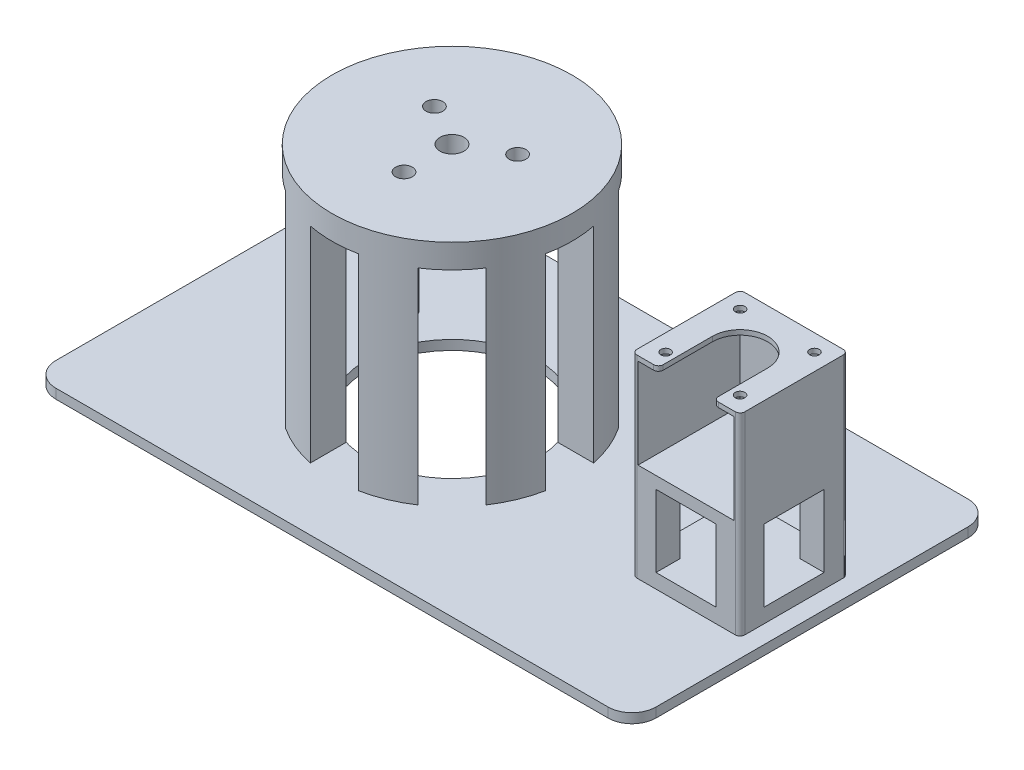
from build123d import *

# Parameters (mm, degrees)
SKETCH1_R            = 50
BOSS_EXTRUDE1_DEPTH  = 99.5
BOSS_EXTRUDE2_DEPTH  = 4
SKETCH3_R            = 5
CUT_EXTRUDE1_DEPTH   = 20
SKETCH6_R            = 35.5
CUT_EXTRUDE2_DEPTH   = 89.5
SKETCH7_W            = 20
SKETCH7_H            = 85.5
CUT_EXTRUDE3_DEPTH   = 196.000641025
CIRPATTERN1_COUNT    = 8
SKETCH8_R            = 4.5
SKETCH8_R_2          = 1.5
EXTRUDE_THIN1_DEPTH  = 40
SKETCH8_2_R          = 1.5
CUT_EXTRUDE4_DEPTH   = 191.092740524
SKETCH9_R            = 3.5
CUT_EXTRUDE5_DEPTH   = 5
FILLET1_R            = 2
SKETCH4_W            = 45
SKETCH4_H            = 45
BOSS_EXTRUDE3_DEPTH  = 41
EXTRUDE_THIN2_DEPTH  = 37.5
SKETCH11_R           = 2
BOSS_EXTRUDE4_DEPTH  = 2
FILLET2_R            = 2
SKETCH12_W           = 25
SKETCH12_H           = 30
CUT_EXTRUDE6_DEPTH   = 205.710771578
CUT_EXTRUDE7_REACH   = 274.638
SKETCH13_W           = 25
SKETCH13_H           = 30
SPLIT1_START         = 4
SPLIT1_OUTLINE_R     = 50
SPLIT1_OUTLINE_R_2   = 5
SPLIT1_OUTLINE_R_3   = 1.5
SPLIT1_DEPTH         = 95.5
SPLIT1_2_DEPTH       = 95.5
SPLIT1_START_2       = 89.5
SPLIT1_3_OUTLINE_R   = 3.5
SPLIT1_3_OUTLINE_R_2 = 5
SPLIT1_3_DEPTH       = 10
SPLIT1_START_3       = 49.5
SPLIT1_4_OUTLINE_R   = 4.5
SPLIT1_4_OUTLINE_R_2 = 1.5
SPLIT1_4_DEPTH       = 45
SPLIT1_8_DEPTH       = 41
SPLIT1_START_4       = 40
SPLIT1_9_DEPTH       = 44.5
SPLIT1_10_DEPTH      = 6
SPLIT1_11_DEPTH      = 5
SPLIT1_START_5       = 82.5
SPLIT1_12_OUTLINE_R  = 2
SPLIT1_12_DEPTH      = 2


with BuildPart() as part:
    # Sketch1 → Boss-Extrude1 (new body)
    with BuildSketch(Plane(origin=(0, 0, 0), x_dir=(1, 0, 0), z_dir=(0, 1, 0))):
        with Locations(Location((0, 0, 0), (0, 0, 270))):
            Circle(SKETCH1_R)
    extrude(amount=BOSS_EXTRUDE1_DEPTH)

    # Sketch2 → Boss-Extrude2 (add)
    with BuildSketch(Plane(origin=(0, 0, 0), x_dir=(1, 0, 0), z_dir=(0, 1, 0))):
        with BuildLine():
            Line((-90, 75), (140, 75))
            ThreePointArc((140, 75), (147.071067812, 72.071067812), (150, 65))
            Line((150, 65), (150, -65))
            ThreePointArc((150, -65), (147.071067812, -72.071067812), (140, -75))
            Line((140, -75), (-90, -75))
            ThreePointArc((-90, -75), (-97.071067812, -72.071067812), (-100, -65))
            Line((-100, -65), (-100, 65))
            ThreePointArc((-100, 65), (-97.071067812, 72.071067812), (-90, 75))
        make_face()
    extrude(amount=BOSS_EXTRUDE2_DEPTH)

    # Sketch3 → Cut-Extrude1 (cut)
    with BuildSketch(Plane(origin=(0, 99.5, 0), x_dir=(1, 0, 0), z_dir=(0, 1, 0))):
        with Locations(Location((0, 0, 0), (0, 0, 270))):
            Circle(SKETCH3_R)
    extrude(amount=-CUT_EXTRUDE1_DEPTH, mode=Mode.SUBTRACT)

    # Sketch6 → Cut-Extrude2 (cut)
    with BuildSketch(Plane.XZ):
        with Locations(Location((0, 0, 0), (0, 0, 270))):
            Circle(SKETCH6_R)
    extrude(amount=-CUT_EXTRUDE2_DEPTH, mode=Mode.SUBTRACT)

    # Sketch7 → Cut-Extrude3 (cut, symmetric)
    with BuildSketch(Plane.XY):
        with Locations((0, 46.75)):
            Rectangle(SKETCH7_W, SKETCH7_H)
    cut_extrude3 = extrude(amount=CUT_EXTRUDE3_DEPTH, both=True, mode=Mode.SUBTRACT)

    # CirPattern1: Cut-Extrude3 ×8 about axis
    cirpattern1_axis = Axis((0, 0, 0), (0, 1, 0))
    for i in range(1, CIRPATTERN1_COUNT):
        add(cut_extrude3.rotate(cirpattern1_axis, i * 360 / CIRPATTERN1_COUNT), mode=Mode.SUBTRACT)

    # Sketch8 → Extrude-Thin1 (add)
    # profile 1 of 3: a face of its own
    with BuildSketch(Plane.XZ.offset(-89.5)):
        with Locations((0, 20)):
            Circle(SKETCH8_R)
        with Locations((0, 20)):
            Circle(SKETCH8_R_2, mode=Mode.SUBTRACT)
    # profile 2 of 3: a face of its own
    with BuildSketch(Plane.XZ.offset(-89.5)):
        with Locations((17.320508076, -10)):
            Circle(SKETCH8_R)
        with Locations((17.320508076, -10)):
            Circle(SKETCH8_R_2, mode=Mode.SUBTRACT)
    # profile 3 of 3: a face of its own
    with BuildSketch(Plane.XZ.offset(-89.5)):
        with Locations((-17.320508076, -10)):
            Circle(SKETCH8_R)
        with Locations((-17.320508076, -10)):
            Circle(SKETCH8_R_2, mode=Mode.SUBTRACT)
    extrude(amount=EXTRUDE_THIN1_DEPTH)

    # Sketch8<2> → Cut-Extrude4 (cut, through all)
    with BuildSketch(Plane.XZ.offset(-89.5)):
        with Locations(Location((0, 20, 0), (0, 0, 270))):
            Circle(SKETCH8_2_R)
        with Locations(Location((17.320508076, -10, 0), (0, 0, 270))):
            Circle(SKETCH8_2_R)
        with Locations(Location((-17.320508076, -10, 0), (0, 0, 270))):
            Circle(SKETCH8_2_R)
    extrude(amount=-CUT_EXTRUDE4_DEPTH, mode=Mode.SUBTRACT)

    # Sketch9 → Cut-Extrude5 (cut)
    with BuildSketch(Plane(origin=(0, 99.5, 0), x_dir=(1, 0, 0), z_dir=(0, 1, 0))):
        with Locations(Location((0, -20, 0), (0, 0, 270))):
            Circle(SKETCH9_R)
        with Locations(Location((-17.320508076, 10, 0), (0, 0, 270))):
            Circle(SKETCH9_R)
        with Locations(Location((17.320508076, 10, 0), (0, 0, 270))):
            Circle(SKETCH9_R)
    extrude(amount=-CUT_EXTRUDE5_DEPTH, mode=Mode.SUBTRACT)

    # Fillet1
    fillet1_edges = [part.edges().sort_by_distance(p)[0] for p in [
        (-4.5, 89.5, 20),
        (12.820508076, 89.5, -10),
        (-21.820508076, 89.5, -10),
    ]]
    fillet(fillet1_edges, radius=FILLET1_R)

    # Sketch4 → Boss-Extrude3 (add)
    with BuildSketch(Plane(origin=(0, 4, 0), x_dir=(1, 0, 0), z_dir=(0, 1, 0))):
        with Locations((120, 0)):
            Rectangle(SKETCH4_W, SKETCH4_H)
    extrude(amount=BOSS_EXTRUDE3_DEPTH)

    # Sketch10 → Extrude-Thin2 (add)
    with BuildSketch(Plane(origin=(0, 45, 0), x_dir=(1, 0, 0), z_dir=(0, 1, 0))):
        Polygon((97.5, -22.5), (97.5, 22.5), (142.5, 22.5), (142.5, -22.5), (140, -22.5), (140, 20), (100, 20), (100, -22.5), align=None)
    extrude(amount=EXTRUDE_THIN2_DEPTH)

    # Sketch11 → Boss-Extrude4 (add)
    # profile 1 of 2: a face of its own
    with BuildSketch(Plane(origin=(0, 82.5, 0), x_dir=(1, 0, 0), z_dir=(0, 1, 0))):
        Polygon((100, 20), (140, 20), (140, -22.5), (142.5, -22.5), (142.5, 22.5), (97.5, 22.5), (97.5, -22.5), (100, -22.5), align=None)
    # profile 2 of 2: a face of its own
    with BuildSketch(Plane(origin=(0, 82.5, 0), x_dir=(1, 0, 0), z_dir=(0, 1, 0))):
        with BuildLine():
            Line((108.5, -22.5), (108.5, 0))
            ThreePointArc((108.5, 0), (120, 11.5), (131.5, 0))
            Line((131.5, 0), (131.5, -22.5))
            Line((131.5, -22.5), (140, -22.5))
            Line((140, -22.5), (140, 20))
            Line((140, 20), (100, 20))
            Line((100, 20), (100, -22.5))
            Line((100, -22.5), (108.5, -22.5))
        make_face()
        with Locations(Location((104.5, -15.5, 0), (0, 0, 270))):
            Circle(SKETCH11_R, mode=Mode.SUBTRACT)
        with Locations(Location((135.5, -15.5, 0), (0, 0, 270))):
            Circle(SKETCH11_R, mode=Mode.SUBTRACT)
        with Locations(Location((104.5, 15.5, 0), (0, 0, 270))):
            Circle(SKETCH11_R, mode=Mode.SUBTRACT)
        with Locations(Location((135.5, 15.5, 0), (0, 0, 270))):
            Circle(SKETCH11_R, mode=Mode.SUBTRACT)
    extrude(amount=BOSS_EXTRUDE4_DEPTH)

    # Fillet2
    fillet2_edges = [part.edges().sort_by_distance(p)[0] for p in [
        (142.5, 44.25, 22.5),
        (142.5, 44.25, -22.5),
        (97.5, 44.25, -22.5),
        (97.5, 44.25, 22.5),
        (131.5, 83.5, 22.5),
        (108.5, 83.5, 22.5),
    ]]
    fillet(fillet2_edges, radius=FILLET2_R)

    # Sketch12 → Cut-Extrude6 (cut, through all)
    with BuildSketch(Plane.XY.offset(22.5)):
        with Locations((120, 25)):
            Rectangle(SKETCH12_W, SKETCH12_H)
    extrude(amount=-CUT_EXTRUDE6_DEPTH, mode=Mode.SUBTRACT)

    # Cut-Extrude7: up to this face of the body (flat: up to its plane)
    cut_extrude7_end = Plane(part.part.faces().sort_by_distance((97.5, 44.25, 0))[0])
    # Sketch13 → Cut-Extrude7 (cut, up to the picked face)
    with BuildSketch(Plane(origin=(142.5, 0, 0), x_dir=(0, 0, -1), z_dir=(1, 0, 0)), mode=Mode.PRIVATE) as cut_extrude7_sk1:
        with Locations((0, 25)):
            Rectangle(SKETCH13_W, SKETCH13_H)
    cut_extrude7_tool1 = split(extrude(cut_extrude7_sk1.sketch, amount=-CUT_EXTRUDE7_REACH, mode=Mode.PRIVATE), bisect_by=cut_extrude7_end, keep=Keep.BOTH, mode=Mode.PRIVATE)
    add(cut_extrude7_tool1.solids().sort_by(Axis((142.5, 25, 0), (-1, 0, 0)))[0], mode=Mode.SUBTRACT)

    # Split1: read off the stored shape, not the designer's step
    # Split1 outline → Split1 (cut)
    # profile 1 of 2: a face of its own
    with BuildSketch(Plane(origin=(0, 0, 0), x_dir=(1, 0, 0), z_dir=(0, 1, 0)).offset(SPLIT1_START)):
        with BuildLine():
            ThreePointArc((142.5, 20.5), (141.914213562, 21.914213562), (140.5, 22.5))
            Line((140.5, 22.5), (99.5, 22.5))
            ThreePointArc((99.5, 22.5), (98.085786438, 21.914213562), (97.5, 20.5))
            Line((97.5, 20.5), (97.5, -20.5))
            ThreePointArc((97.5, -20.5), (98.085786438, -21.914213562), (99.5, -22.5))
            Line((99.5, -22.5), (140.5, -22.5))
            ThreePointArc((140.5, -22.5), (141.914213562, -21.914213562), (142.5, -20.5))
            Line((142.5, -20.5), (142.5, 20.5))
        make_face()
    # profile 2 of 2: a face of its own
    with BuildSketch(Plane(origin=(0, 0, 0), x_dir=(1, 0, 0), z_dir=(0, 1, 0)).offset(SPLIT1_START)):
        Circle(SPLIT1_OUTLINE_R)
        Circle(SPLIT1_OUTLINE_R_2, mode=Mode.SUBTRACT)
        with Locations((17.320508076, 10)):
            Circle(SPLIT1_OUTLINE_R_3, mode=Mode.SUBTRACT)
        with Locations((-17.320508076, 10)):
            Circle(SPLIT1_OUTLINE_R_3, mode=Mode.SUBTRACT)
        with Locations((0, -20)):
            Circle(SPLIT1_OUTLINE_R_3, mode=Mode.SUBTRACT)
    extrude(amount=SPLIT1_DEPTH, mode=Mode.SUBTRACT)


with BuildPart() as body_2:
    # Split1 2 outline → Split1 2 (new body)
    with BuildSketch(Plane(origin=(0, 0, 0), x_dir=(1, 0, 0), z_dir=(0, 1, 0)).offset(SPLIT1_START)):
        with BuildLine():
            Line((48.989794856, -10), (34.062442661, -10))
            ThreePointArc((34.062442661, -10), (32.797723404, -13.585261849), (31.156852001, -17.014716377))
            Line((31.156852001, -17.014716377), (41.712083963, -27.56994834))
            ThreePointArc((41.712083963, -27.56994834), (46.193976625, -19.134171618), (48.989794856, -10))
        make_face()
        with BuildLine():
            ThreePointArc((10, -48.989794856), (19.134171618, -46.193976625), (27.56994834, -41.712083963))
            Line((27.56994834, -41.712083963), (17.014716377, -31.156852001))
            ThreePointArc((17.014716377, -31.156852001), (13.585261849, -32.797723404), (10, -34.062442661))
            Line((10, -34.062442661), (10, -48.989794856))
        make_face()
        with BuildLine():
            Line((34.062442661, 10), (48.989794856, 10))
            ThreePointArc((48.989794856, 10), (46.193976625, 19.134171618), (41.712083963, 27.56994834))
            Line((41.712083963, 27.56994834), (31.156852001, 17.014716377))
            ThreePointArc((31.156852001, 17.014716377), (32.797723404, 13.585261849), (34.062442661, 10))
        make_face()
        with BuildLine():
            ThreePointArc((-27.56994834, -41.712083963), (-19.134171618, -46.193976625), (-10, -48.989794856))
            Line((-10, -48.989794856), (-10, -34.062442661))
            ThreePointArc((-10, -34.062442661), (-13.585261849, -32.797723404), (-17.014716377, -31.156852001))
            Line((-17.014716377, -31.156852001), (-27.56994834, -41.712083963))
        make_face()
        with BuildLine():
            Line((17.014716377, 31.156852001), (27.56994834, 41.712083963))
            ThreePointArc((27.56994834, 41.712083963), (19.134171618, 46.193976625), (10, 48.989794856))
            Line((10, 48.989794856), (10, 34.062442661))
            ThreePointArc((10, 34.062442661), (13.585261849, 32.797723404), (17.014716377, 31.156852001))
        make_face()
        with BuildLine():
            ThreePointArc((-48.989794856, -10), (-46.193976625, -19.134171618), (-41.712083963, -27.56994834))
            Line((-41.712083963, -27.56994834), (-31.156852001, -17.014716377))
            ThreePointArc((-31.156852001, -17.014716377), (-32.797723404, -13.585261849), (-34.062442661, -10))
            Line((-34.062442661, -10), (-48.989794856, -10))
        make_face()
        with BuildLine():
            Line((-10, 34.062442661), (-10, 48.989794856))
            ThreePointArc((-10, 48.989794856), (-19.134171618, 46.193976625), (-27.56994834, 41.712083963))
            Line((-27.56994834, 41.712083963), (-17.014716377, 31.156852001))
            ThreePointArc((-17.014716377, 31.156852001), (-13.585261849, 32.797723404), (-10, 34.062442661))
        make_face()
        with BuildLine():
            ThreePointArc((-41.712083963, 27.56994834), (-46.193976625, 19.134171618), (-48.989794856, 10))
            Line((-48.989794856, 10), (-34.062442661, 10))
            ThreePointArc((-34.062442661, 10), (-32.797723404, 13.585261849), (-31.156852001, 17.014716377))
            Line((-31.156852001, 17.014716377), (-41.712083963, 27.56994834))
        make_face()
    extrude(amount=SPLIT1_2_DEPTH)

    # Split1 3 outline → Split1 3 (add)
    with BuildSketch(Plane(origin=(0, 0, 0), x_dir=(1, 0, 0), z_dir=(0, 1, 0)).offset(SPLIT1_START_2)):
        with BuildLine():
            ThreePointArc((31.156852001, -17.014716377), (32.797723404, -13.585261849), (34.062442661, -10))
            Line((34.062442661, -10), (48.989794856, -10))
            ThreePointArc((48.989794856, -10), (50, 0), (48.989794856, 10))
            Line((48.989794856, 10), (34.062442661, 10))
            ThreePointArc((34.062442661, 10), (32.797723404, 13.585261849), (31.156852001, 17.014716377))
            Line((31.156852001, 17.014716377), (41.712083963, 27.56994834))
            ThreePointArc((41.712083963, 27.56994834), (35.355339059, 35.355339059), (27.56994834, 41.712083963))
            Line((27.56994834, 41.712083963), (17.014716377, 31.156852001))
            ThreePointArc((17.014716377, 31.156852001), (13.585261849, 32.797723404), (10, 34.062442661))
            Line((10, 34.062442661), (10, 48.989794856))
            ThreePointArc((10, 48.989794856), (0, 50), (-10, 48.989794856))
            Line((-10, 48.989794856), (-10, 34.062442661))
            ThreePointArc((-10, 34.062442661), (-13.585261849, 32.797723404), (-17.014716377, 31.156852001))
            Line((-17.014716377, 31.156852001), (-27.56994834, 41.712083963))
            ThreePointArc((-27.56994834, 41.712083963), (-35.355339059, 35.355339059), (-41.712083963, 27.56994834))
            Line((-41.712083963, 27.56994834), (-31.156852001, 17.014716377))
            ThreePointArc((-31.156852001, 17.014716377), (-32.797723404, 13.585261849), (-34.062442661, 10))
            Line((-34.062442661, 10), (-48.989794856, 10))
            ThreePointArc((-48.989794856, 10), (-50, 0), (-48.989794856, -10))
            Line((-48.989794856, -10), (-34.062442661, -10))
            ThreePointArc((-34.062442661, -10), (-32.797723404, -13.585261849), (-31.156852001, -17.014716377))
            Line((-31.156852001, -17.014716377), (-41.712083963, -27.56994834))
            ThreePointArc((-41.712083963, -27.56994834), (-35.355339059, -35.355339059), (-27.56994834, -41.712083963))
            Line((-27.56994834, -41.712083963), (-17.014716377, -31.156852001))
            ThreePointArc((-17.014716377, -31.156852001), (-13.585261849, -32.797723404), (-10, -34.062442661))
            Line((-10, -34.062442661), (-10, -48.989794856))
            ThreePointArc((-10, -48.989794856), (0, -50), (10, -48.989794856))
            Line((10, -48.989794856), (10, -34.062442661))
            ThreePointArc((10, -34.062442661), (13.585261849, -32.797723404), (17.014716377, -31.156852001))
            Line((17.014716377, -31.156852001), (27.56994834, -41.712083963))
            ThreePointArc((27.56994834, -41.712083963), (35.355339059, -35.355339059), (41.712083963, -27.56994834))
            Line((41.712083963, -27.56994834), (31.156852001, -17.014716377))
        make_face()
        with Locations((0, -20)):
            Circle(SPLIT1_3_OUTLINE_R, mode=Mode.SUBTRACT)
        Circle(SPLIT1_3_OUTLINE_R_2, mode=Mode.SUBTRACT)
        with Locations((17.320508076, 10)):
            Circle(SPLIT1_3_OUTLINE_R, mode=Mode.SUBTRACT)
        with Locations((-17.320508076, 10)):
            Circle(SPLIT1_3_OUTLINE_R, mode=Mode.SUBTRACT)
    extrude(amount=SPLIT1_3_DEPTH)

    # Split1 4 outline → Split1 4 (add)
    # profile 1 of 3: a face of its own
    with BuildSketch(Plane(origin=(0, 0, 0), x_dir=(1, 0, 0), z_dir=(0, 1, 0)).offset(SPLIT1_START_3)):
        with Locations((0, -20)):
            Circle(SPLIT1_4_OUTLINE_R)
        with Locations((0, -20)):
            Circle(SPLIT1_4_OUTLINE_R_2, mode=Mode.SUBTRACT)
    # profile 2 of 3: a face of its own
    with BuildSketch(Plane(origin=(0, 0, 0), x_dir=(1, 0, 0), z_dir=(0, 1, 0)).offset(SPLIT1_START_3)):
        with Locations((-17.320508076, 10)):
            Circle(SPLIT1_4_OUTLINE_R)
        with Locations((-17.320508076, 10)):
            Circle(SPLIT1_4_OUTLINE_R_2, mode=Mode.SUBTRACT)
    # profile 3 of 3: a face of its own
    with BuildSketch(Plane(origin=(0, 0, 0), x_dir=(1, 0, 0), z_dir=(0, 1, 0)).offset(SPLIT1_START_3)):
        with Locations((17.320508076, 10)):
            Circle(SPLIT1_4_OUTLINE_R)
        with Locations((17.320508076, 10)):
            Circle(SPLIT1_4_OUTLINE_R_2, mode=Mode.SUBTRACT)
    extrude(amount=SPLIT1_4_DEPTH)

    # Split1 5 outline → Split1 5 (revolve)
    with BuildSketch(Plane.XY.offset(20)):
        with BuildLine():
            ThreePointArc((4.5, 87.5), (5.085786438, 88.914213562), (6.5, 89.5))
            Line((6.5, 89.5), (4.5, 89.5))
            Line((4.5, 89.5), (4.5, 87.5))
        make_face()
    revolve(axis=Axis((0, 0, 20), (0, 1, 0)))

    # Split1 6 outline → Split1 6 (revolve)
    with BuildSketch(Plane(origin=(-17.320508076, 0, -10), x_dir=(1, 0, 0), z_dir=(0, 0, 1))):
        with BuildLine():
            ThreePointArc((4.5, 87.5), (5.085786438, 88.914213562), (6.5, 89.5))
            Line((6.5, 89.5), (4.5, 89.5))
            Line((4.5, 89.5), (4.5, 87.5))
        make_face()
    revolve(axis=Axis((-17.320508076, 0, -10), (0, 1, 0)))

    # Split1 7 outline → Split1 7 (revolve)
    with BuildSketch(Plane(origin=(17.320508076, 0, -10), x_dir=(1, 0, 0), z_dir=(0, 0, 1))):
        with BuildLine():
            ThreePointArc((4.5, 87.5), (5.085786438, 88.914213562), (6.5, 89.5))
            Line((6.5, 89.5), (4.5, 89.5))
            Line((4.5, 89.5), (4.5, 87.5))
        make_face()
    revolve(axis=Axis((17.320508076, 0, -10), (0, 1, 0)))


with BuildPart() as body_3:
    # Split1 8 outline → Split1 8 (new body)
    with BuildSketch(Plane(origin=(0, 0, 0), x_dir=(1, 0, 0), z_dir=(0, 1, 0)).offset(SPLIT1_START)):
        with BuildLine():
            Line((132.5, 12.5), (142.5, 12.5))
            Line((142.5, 12.5), (142.5, 20.5))
            ThreePointArc((142.5, 20.5), (141.914213562, 21.914213562), (140.5, 22.5))
            Line((140.5, 22.5), (132.5, 22.5))
            Line((132.5, 22.5), (132.5, 12.5))
        make_face()
        with BuildLine():
            Line((107.5, 12.5), (107.5, 22.5))
            Line((107.5, 22.5), (99.5, 22.5))
            ThreePointArc((99.5, 22.5), (98.085786438, 21.914213562), (97.5, 20.5))
            Line((97.5, 20.5), (97.5, 12.5))
            Line((97.5, 12.5), (107.5, 12.5))
        make_face()
        with BuildLine():
            ThreePointArc((140.5, -22.5), (141.914213562, -21.914213562), (142.5, -20.5))
            Line((142.5, -20.5), (142.5, -12.5))
            Line((142.5, -12.5), (132.5, -12.5))
            Line((132.5, -12.5), (132.5, -22.5))
            Line((132.5, -22.5), (140.5, -22.5))
        make_face()
        with BuildLine():
            Line((99.5, -22.5), (107.5, -22.5))
            Line((107.5, -22.5), (107.5, -12.5))
            Line((107.5, -12.5), (97.5, -12.5))
            Line((97.5, -12.5), (97.5, -20.5))
            ThreePointArc((97.5, -20.5), (98.085786438, -21.914213562), (99.5, -22.5))
        make_face()
    extrude(amount=SPLIT1_8_DEPTH)

    # Split1 9 outline → Split1 9 (add)
    with BuildSketch(Plane(origin=(0, 0, 0), x_dir=(1, 0, 0), z_dir=(0, 1, 0)).offset(SPLIT1_START_4)):
        with BuildLine():
            Line((140, 20), (140, -22.5))
            Line((140, -22.5), (140.5, -22.5))
            ThreePointArc((140.5, -22.5), (141.914213562, -21.914213562), (142.5, -20.5))
            Line((142.5, -20.5), (142.5, 20.5))
            ThreePointArc((142.5, 20.5), (141.914213562, 21.914213562), (140.5, 22.5))
            Line((140.5, 22.5), (99.5, 22.5))
            ThreePointArc((99.5, 22.5), (98.085786438, 21.914213562), (97.5, 20.5))
            Line((97.5, 20.5), (97.5, -20.5))
            ThreePointArc((97.5, -20.5), (98.085786438, -21.914213562), (99.5, -22.5))
            Line((99.5, -22.5), (100, -22.5))
            Line((100, -22.5), (100, 20))
            Line((100, 20), (140, 20))
        make_face()
    extrude(amount=SPLIT1_9_DEPTH)

    # Split1 10 outline → Split1 10 (add)
    with BuildSketch(Plane(origin=(0, 0, 0), x_dir=(1, 0, 0), z_dir=(0, 1, 0)).offset(SPLIT1_START)):
        Polygon((132.5, 12.5), (132.5, 22.5), (107.5, 22.5), (107.5, 12.5), (97.5, 12.5), (97.5, -12.5), (107.5, -12.5), (107.5, -22.5), (132.5, -22.5), (132.5, -12.5), (142.5, -12.5), (142.5, 12.5), align=None)
    extrude(amount=SPLIT1_10_DEPTH)

    # Split1 11 outline → Split1 11 (add)
    with BuildSketch(Plane(origin=(0, 0, 0), x_dir=(1, 0, 0), z_dir=(0, 1, 0)).offset(SPLIT1_START_4)):
        Polygon((132.5, 12.5), (132.5, 20), (107.5, 20), (107.5, 12.5), (100, 12.5), (100, -12.5), (107.5, -12.5), (107.5, -22.5), (132.5, -22.5), (132.5, -12.5), (140, -12.5), (140, 12.5), align=None)
    extrude(amount=SPLIT1_11_DEPTH)

    # Split1 12 outline → Split1 12 (add)
    with BuildSketch(Plane(origin=(0, 0, 0), x_dir=(1, 0, 0), z_dir=(0, 1, 0)).offset(SPLIT1_START_5)):
        with BuildLine():
            Line((140, 20), (100, 20))
            Line((100, 20), (100, -22.5))
            Line((100, -22.5), (106.5, -22.5))
            ThreePointArc((106.5, -22.5), (107.914213562, -21.914213562), (108.5, -20.5))
            Line((108.5, -20.5), (108.5, 0))
            ThreePointArc((108.5, 0), (120, 11.5), (131.5, 0))
            Line((131.5, 0), (131.5, -20.5))
            ThreePointArc((131.5, -20.5), (132.085786438, -21.914213562), (133.5, -22.5))
            Line((133.5, -22.5), (140, -22.5))
            Line((140, -22.5), (140, 20))
        make_face()
        with Locations((135.5, 15.5)):
            Circle(SPLIT1_12_OUTLINE_R, mode=Mode.SUBTRACT)
        with Locations((104.5, 15.5)):
            Circle(SPLIT1_12_OUTLINE_R, mode=Mode.SUBTRACT)
        with Locations((135.5, -15.5)):
            Circle(SPLIT1_12_OUTLINE_R, mode=Mode.SUBTRACT)
        with Locations((104.5, -15.5)):
            Circle(SPLIT1_12_OUTLINE_R, mode=Mode.SUBTRACT)
    extrude(amount=SPLIT1_12_DEPTH)


solid = Compound([part.part, body_2.part, body_3.part])
